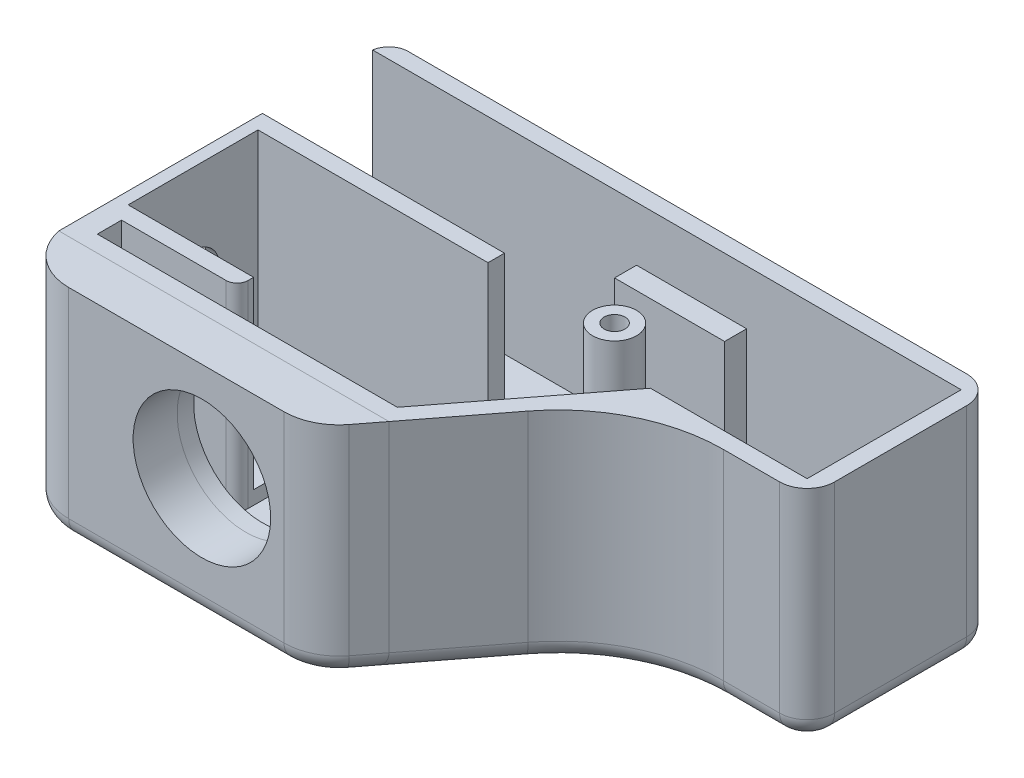
from build123d import *

# Parameters (mm, degrees)
BOSS_EXTRUDE1_DEPTH = 2.54
BOSS_EXTRUDE2_DEPTH = 22.7965
SKETCH3_W           = 27.94
SKETCH3_H           = 1.905
SKETCH3_W_2         = 15.875
BOSS_EXTRUDE3_DEPTH = 22.7965
SKETCH4_W           = 2.794
SKETCH4_H           = 22.7965
SKETCH4_W_2         = 1.651
SKETCH4_H_2         = 4.445
BOSS_EXTRUDE4_DEPTH = 2.54
FILLET5_R           = 1.27
SKETCH6_W           = 38.1
SKETCH6_H           = 5.08
BOSS_EXTRUDE5_DEPTH = 25.3365
CUT_EXTRUDE1_START  = -6.985
SKETCH7_R           = 7.9375
CUT_EXTRUDE1_DEPTH  = 6.985
CUT_EXTRUDE2_DEPTH  = 86.938775487
SKETCH10_R          = 2.54
SKETCH10_R_2        = 1.2065
BOSS_EXTRUDE6_DEPTH = 22.7965
FILLET6_R           = 19.05
FILLET7_R           = 6.35
FILLET8_R           = 3.175
FILLET9_R           = 2.2225
FILLET10_R          = 2.2225
FILLET11_R          = 2.2225
SKETCH11_W          = 15.875
SKETCH11_H          = 14.986
BOSS_EXTRUDE7_DEPTH = 1.56845
SKETCH12_W          = 14.986
SKETCH12_H          = 21.22805
SKETCH12_R          = 3.048
BOSS_EXTRUDE8_DEPTH = 1.397
SKETCH14_R          = 2.5781
CUT_EXTRUDE3_DEPTH  = 1.905
SKETCH15_W          = 12.7
SKETCH15_H          = 2.54
BOSS_EXTRUDE9_DEPTH = 20.32
SKETCH16_W          = 9.652
SKETCH16_H          = 4.953
CUT_EXTRUDE4_DEPTH  = 3.556


with BuildPart() as part:
    # Sketch1 → Boss-Extrude1 (new body)
    with BuildSketch(Plane(origin=(0, 0, 0), x_dir=(1, 0, 0), z_dir=(0, 1, 0))):
        Polygon((0, 0), (69.85, 0), (69.85, -21.59), (50.8, -21.59), (38.1, -38.1), (0, -38.1), align=None)
    extrude(amount=BOSS_EXTRUDE1_DEPTH)

    # Sketch2 → Boss-Extrude2 (add)
    with BuildSketch(Plane(origin=(0, 2.54, 0), x_dir=(1, 0, 0), z_dir=(0, 1, 0))):
        Polygon((0, 0), (0, -1.905), (67.945, -1.905), (67.945, -19.685), (49.861975147, -19.685), (37.161975147, -36.195), (0, -36.195), (0, -38.1), (38.1, -38.1), (50.8, -21.59), (69.85, -21.59), (69.85, 0), align=None)
    extrude(amount=BOSS_EXTRUDE2_DEPTH)

    # Sketch3 → Boss-Extrude3 (add)
    with BuildSketch(Plane(origin=(0, 2.54, 0), x_dir=(1, 0, 0), z_dir=(0, 1, 0))):
        with Locations((13.97, -15.5575)):
            Rectangle(SKETCH3_W, SKETCH3_H)
        with Locations((7.9375, -32.4485)):
            Rectangle(SKETCH3_W_2, SKETCH3_H)
    extrude(amount=BOSS_EXTRUDE3_DEPTH)

    # Sketch4 → Boss-Extrude4 (add)
    with BuildSketch(Plane.ZY):
        with Locations((34.798, 13.93825)):
            Rectangle(SKETCH4_W, SKETCH4_H)
        with Locations((34.798, 13.93825)):
            Rectangle(SKETCH4_W_2, SKETCH4_H_2, mode=Mode.SUBTRACT)
    extrude(amount=-BOSS_EXTRUDE4_DEPTH)

    # Fillet5
    fillet5_edges = [part.edges().sort_by_distance(p)[0] for p in [
        (15.875, 13.93825, 33.401),
    ]]
    fillet(fillet5_edges, radius=FILLET5_R)


with BuildPart() as body_2:
    # Sketch6 → Boss-Extrude5 (new body)
    with BuildSketch(Plane(origin=(0, 25.3365, 0), x_dir=(1, 0, 0), z_dir=(0, 1, 0))):
        with Locations((19.05, -40.64)):
            Rectangle(SKETCH6_W, SKETCH6_H)
    extrude(amount=-BOSS_EXTRUDE5_DEPTH)


with BuildPart() as cut_extrude1_tool:
    # Sketch7 → Cut-Extrude1 (new body)
    with BuildSketch(Plane.XY.offset(43.18).offset(CUT_EXTRUDE1_START)):
        with Locations((21.59, 13.93825)):
            Circle(SKETCH7_R)
    extrude(amount=CUT_EXTRUDE1_DEPTH)


with BuildPart() as part_1:
    add(part.part)

    # Cut-Extrude1: cut by cut_extrude1_tool
    add(cut_extrude1_tool.part, mode=Mode.SUBTRACT)

    # Sketch10 → Boss-Extrude6 (add)
    with BuildSketch(Plane(origin=(0, 2.54, 0), x_dir=(1, 0, 0), z_dir=(0, 1, 0))):
        with Locations(Location((41.275, -15.24, 0), (0, 0, 90))):
            Circle(SKETCH10_R)
        with Locations(Location((41.275, -15.24, 0), (0, 0, 270))):
            Circle(SKETCH10_R_2, mode=Mode.SUBTRACT)
    extrude(amount=BOSS_EXTRUDE6_DEPTH)

    # Fillet6
    fillet6_edges = [part_1.edges().sort_by_distance(p)[0] for p in [
        (50.8, 12.66825, 21.59),
    ]]
    fillet(fillet6_edges, radius=FILLET6_R)

    # Fillet8
    fillet8_edges = [part_1.edges().sort_by_distance(p)[0] for p in [
        (69.85, 12.66825, 0),
        (69.85, 12.66825, 21.59),
    ]]
    fillet(fillet8_edges, radius=FILLET8_R)

    # Fillet9
    fillet9_edges = [part_1.edges().sort_by_distance(p)[0] for p in [
        (63.427624263, 0, 21.59),
        (51.764877453, 0, 23.549533953),
        (69.85, 0, 10.795),
        (33.3375, 0, 0),
        (68.92006403, 0, 0.92993597),
        (68.92006403, 0, 20.66006403),
        (41.590380767, 0, 33.562505003),
    ]]
    fillet(fillet9_edges, radius=FILLET9_R)

    # Fillet11
    fillet11_edges = [part_1.edges().sort_by_distance(p)[0] for p in [
        (0, 13.7795, 0),
        (0, 0.650955179, 0.650955179),
        (0, 0, 20.16125),
    ]]
    fillet(fillet11_edges, radius=FILLET11_R)

    # Sketch11 → Boss-Extrude7 (add)
    with BuildSketch(Plane(origin=(0, 2.54, 0), x_dir=(1, 0, 0), z_dir=(0, 1, 0))):
        with Locations((7.9375, -24.003)):
            Rectangle(SKETCH11_W, SKETCH11_H)
    extrude(amount=BOSS_EXTRUDE7_DEPTH)

    # Sketch12 → Boss-Extrude8 (add)
    with BuildSketch(Plane.ZY):
        with Locations((24.003, 14.722475)):
            Rectangle(SKETCH12_W, SKETCH12_H)
        with Locations((24.003, 13.97635)):
            Circle(SKETCH12_R, mode=Mode.SUBTRACT)
    extrude(amount=-BOSS_EXTRUDE8_DEPTH)

    # Sketch14 → Cut-Extrude3 (cut)
    with BuildSketch(Plane(origin=(0, 0, 0), x_dir=(-1, 0, 0), z_dir=(0, 0, -1))):
        with Locations((-61.468, 13.798556219)):
            Circle(SKETCH14_R)
    extrude(amount=-CUT_EXTRUDE3_DEPTH, mode=Mode.SUBTRACT)

    # Sketch15 → Boss-Extrude9 (add)
    with BuildSketch(Plane(origin=(0, 2.54, 0), x_dir=(1, 0, 0), z_dir=(0, 1, 0))):
        with Locations((40.64, -6.985)):
            Rectangle(SKETCH15_W, SKETCH15_H)
    extrude(amount=BOSS_EXTRUDE9_DEPTH)

    # Sketch16 → Cut-Extrude4 (cut)
    with BuildSketch(Plane(origin=(0, 4.10845, 0), x_dir=(1, 0, 0), z_dir=(0, 1, 0))):
        with Locations((15.621, -24.0665)):
            Rectangle(SKETCH16_W, SKETCH16_H)
    extrude(amount=-CUT_EXTRUDE4_DEPTH, mode=Mode.SUBTRACT)


with BuildPart() as body_2_1:
    add(body_2.part)

    # Cut-Extrude1: cut by cut_extrude1_tool
    add(cut_extrude1_tool.part, mode=Mode.SUBTRACT)

    # Sketch9 → Cut-Extrude2 (cut, through all)
    with BuildSketch(Plane(origin=(0, 25.3365, 0), x_dir=(1, 0, 0), z_dir=(0, 1, 0))):
        Polygon((38.1, -38.1), (34.192307692, -43.18), (38.1, -43.18), align=None)
    extrude(amount=-CUT_EXTRUDE2_DEPTH, mode=Mode.SUBTRACT)

    # Fillet7
    # the kernel refuses this fillet: 6.35 mm, written as the material it takes off along each edge
    with BuildSketch(Plane(origin=(0, 40.890759867, 43.18), x_dir=(1.5737716562133841e-12, 0, -1.0), z_dir=(0, -1, 0))) as fillet7_piece_1:
        with BuildLine():
            CenterArc((6.35, 6.221703947), FILLET7_R, 180, 78.463040967)
            Line((0, 6.221703947), (-0.127, 6.221703947))
            Line((-0.127, 6.221703947), (-0.127, 0))
            Line((-0.127, 0), (0, -0.127))
            ThreePointArc((0, -0.127), (2.54, -0.127), (5.0546, -0.124434079))
            Line((5.0546, -0.124434079), (5.08, 0))
        make_face()
    extrude(amount=56.445019733, mode=Mode.SUBTRACT)
    with BuildSketch(Plane(origin=(34.192307692, 33.153373772, 43.18), x_dir=(0.6097107608496929, 0, -0.7926239891045996), z_dir=(0, -1, 0))) as fillet7_piece_2:
        with BuildLine():
            CenterArc((FILLET7_R * 0.492401497451, -FILLET7_R), FILLET7_R, 90, 52.431407971)
            Line((-FILLET7_R * 0.300222491654, -FILLET7_R * 0.39028923915), (-FILLET7_R * 0.316074971436, -FILLET7_R * 0.378095023933))
            Line((-FILLET7_R * 0.316074971436, -FILLET7_R * 0.378095023933), (-FILLET7_R * 0.00984802994901, FILLET7_R * 0.02))
            Line((-FILLET7_R * 0.00984802994901, FILLET7_R * 0.02), (FILLET7_R * 0.492401497451, FILLET7_R * 0.02))
            Line((FILLET7_R * 0.492401497451, FILLET7_R * 0.02), (FILLET7_R * 0.492401497451, 0))
        make_face()
    extrude(amount=40.970247544, mode=Mode.SUBTRACT)

    # Fillet10
    fillet10_edges = [body_2_1.edges().sort_by_distance(p)[0] for p in [
        (37.099360257, 0, 39.400831666),
        (18.643631065, 0, 43.18),
        (33.870681875, 0, 42.526822016),
        (2.205611318, 0, 41.74868885),
    ]]
    fillet(fillet10_edges, radius=FILLET10_R)


solid = Compound([part_1.part, body_2_1.part])
